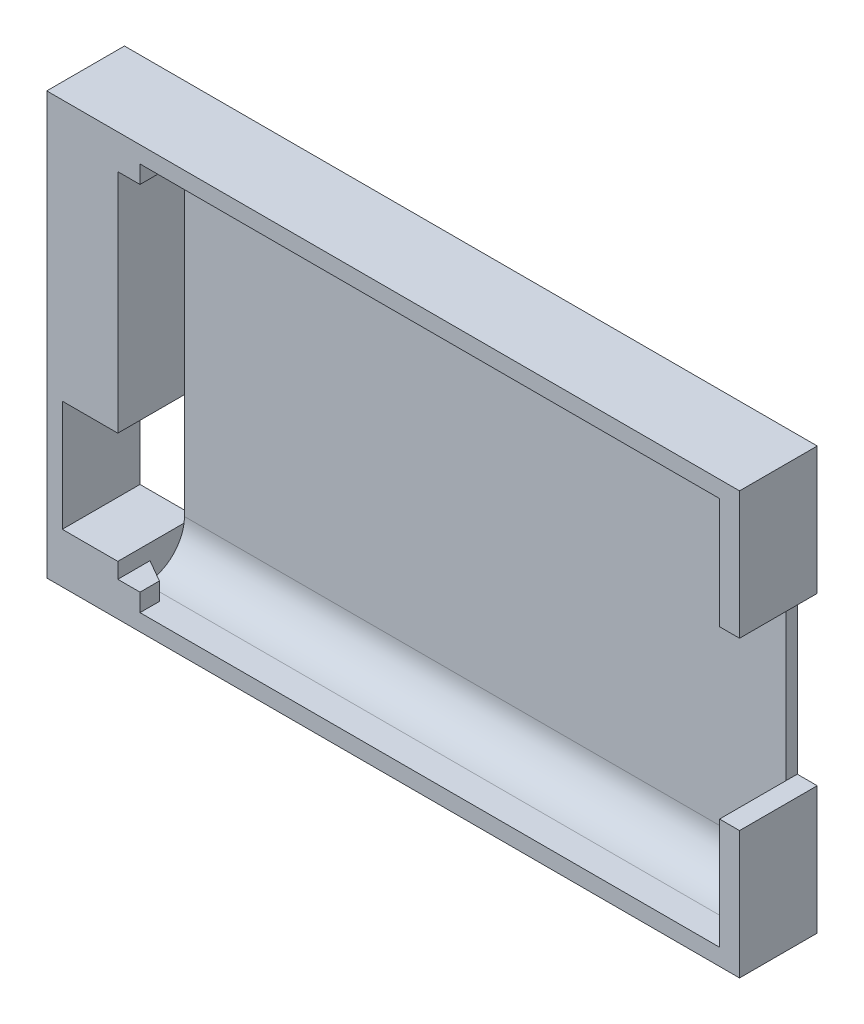
from build123d import *

# Parameters (mm, degrees)
SKETCH2_W                 = 62.4
SKETCH2_H                 = 38
BOSS_EXTRUDE1_DEPTH       = 7
CUT_EXTRUDE1_DEPTH        = 27.1
SKETCH4_W                 = 1.8
SKETCH4_H                 = 15
FORFINGER_DEPTH           = 40.143965052
SKETCH5_W                 = 2
SKETCH5_H                 = 2.9
BOSS_EXTRUDE2_DEPTH       = 1.6
CHAMFER1_SIZE2            = 1.154700538
CHAMFER1_SIZE             = 2
CHAMFER1_OF_MIRROR1_SIZE2 = 1.154700538
CHAMFER1_OF_MIRROR1_SIZE  = 2
SKETCH6_W                 = 5
SKETCH6_H                 = 10
CUT_EXTRUDE3_DEPTH        = 40.143965052


with BuildPart() as part:
    # Sketch2 → Boss-Extrude1 (new body)
    with BuildSketch(Plane.XY):
        with Locations((-2.3, 0)):
            Rectangle(SKETCH2_W, SKETCH2_H)
    extrude(amount=BOSS_EXTRUDE1_DEPTH)

    # Sketch3 → Cut-Extrude1 (cut, symmetric)
    with BuildSketch(Plane(origin=(0, 0, 0), x_dir=(0, 0, -1), z_dir=(1, 0, 0))):
        with BuildLine():
            Line((-8, 17.5), (-4.5, 17.5))
            ThreePointArc((-4.5, 17.5), (-2.025126266, 16.474873734), (-1, 14))
            Line((-1, 14), (-1, -14))
            ThreePointArc((-1, -14), (-2.025126266, -16.474873734), (-4.5, -17.5))
            Line((-4.5, -17.5), (-8, -17.5))
            Line((-8, -17.5), (-8, 17.5))
        make_face()
    extrude(amount=CUT_EXTRUDE1_DEPTH, both=True, mode=Mode.SUBTRACT)

    # Sketch4 → ForFinger (cut, through all)
    with BuildSketch(Plane.XY.offset(7)):
        with Locations((28, 0)):
            Rectangle(SKETCH4_W, SKETCH4_H)
    extrude(amount=-FORFINGER_DEPTH, mode=Mode.SUBTRACT)

    # Sketch5 → Boss-Extrude2 (add)
    with BuildSketch(Plane.XZ.offset(-17.5)):
        with Locations((-26.1, 5.55)):
            Rectangle(SKETCH5_W, SKETCH5_H)
    boss_extrude2 = extrude(amount=BOSS_EXTRUDE2_DEPTH)

    # Chamfer1
    chamfer1_edges = [part.edges().sort_by_distance(p)[0] for p in [
        (-25.1, 16.688533865, 4.1),
    ]]
    chamfer1_side = [part.faces().sort_by_distance(p)[0] for p in [
        (-25.123094011, 16.688533865, 4.1),
    ]]
    chamfer(chamfer1_edges, length=CHAMFER1_SIZE - 0.0001, length2=CHAMFER1_SIZE2 - 0.0001, reference=chamfer1_side[0])  # a hair under: the kernel refuses the full size

    # Mirror1: Boss-Extrude2 across plane
    add(boss_extrude2.mirror(Plane.ZX))

    # Chamfer1 of Mirror1
    chamfer1_of_mirror1_edges = [part.edges().sort_by_distance(p)[0] for p in [
        (-25.1, -16.688533865, 4.1),
    ]]
    chamfer1_of_mirror1_side = [part.faces().sort_by_distance(p)[0] for p in [
        (-25.123094011, -16.688533865, 4.1),
    ]]
    chamfer(chamfer1_of_mirror1_edges, length=CHAMFER1_OF_MIRROR1_SIZE - 0.0001, length2=CHAMFER1_OF_MIRROR1_SIZE2 - 0.0001, reference=chamfer1_of_mirror1_side[0])  # a hair under: the kernel refuses the full size

    # Sketch6 → Cut-Extrude3 (cut, through all)
    with BuildSketch(Plane.XY.offset(7)):
        with Locations((-29.6, -9.5)):
            Rectangle(SKETCH6_W, SKETCH6_H)
    extrude(amount=-CUT_EXTRUDE3_DEPTH, mode=Mode.SUBTRACT)


solid = part.part
